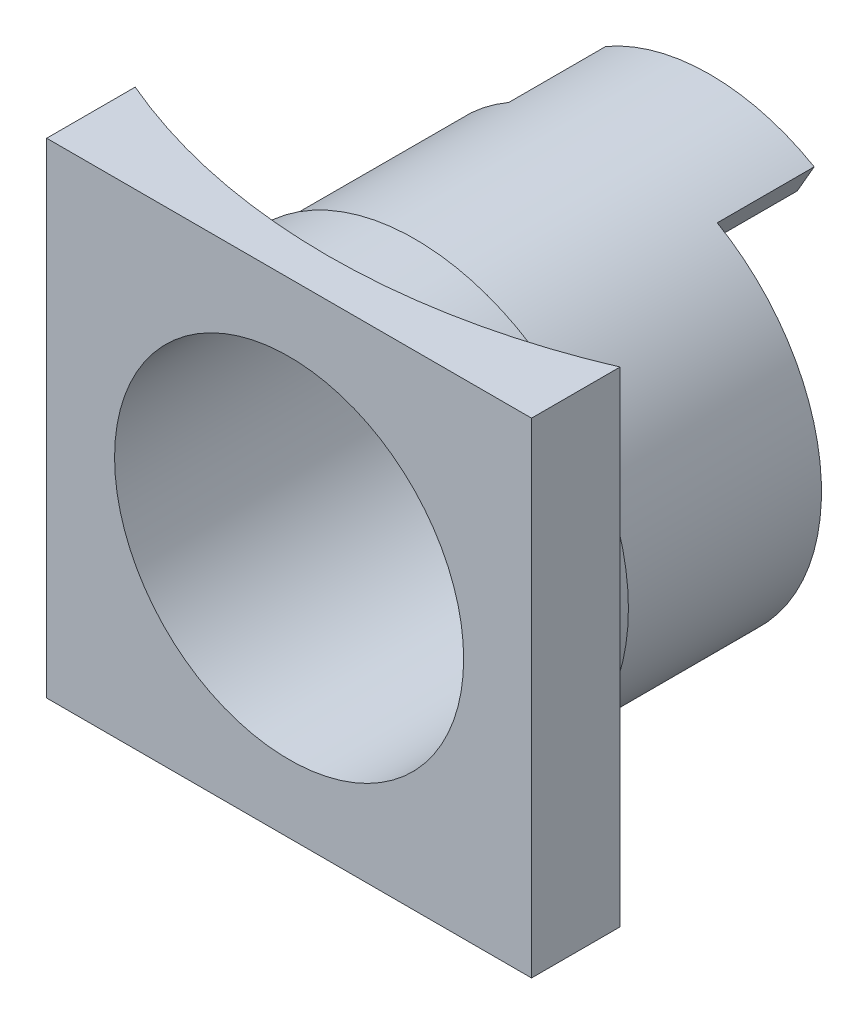
from build123d import *
from build123d.topology import SkipClean

# Parameters (mm, degrees)
EXTRUDE_1_DEPTH     = 25
SKETCH_2_R          = 9
CUT_EXTRUDE_2_DEPTH = 29.321046499
SKETCH_3_R          = 11
SKETCH_3_R_2        = 9
TUBE_DEPTH          = 16.7
SUPPORT_DEPTH       = 5
HOLDER_START        = -15.205
SKETCH_5_R          = 11
SKETCH_5_R_2        = 10.75
HOLDER_DEPTH        = 15.205


with BuildPart() as part:
    # Эскиз1 → Вытянуть1 (new body)
    with BuildSketch(Plane(origin=(0, 0, 0), x_dir=(1, 0, 0), z_dir=(0, 1, 0))):
        with BuildLine():
            Line((-12.5, -29.18582704), (-12.5, -33.75))
            Line((-12.5, -33.75), (12.5, -33.75))
            Line((12.5, -33.75), (12.5, -29.18582704))
            ThreePointArc((12.5, -29.18582704), (0, -31.75), (-12.5, -29.18582704))
        make_face()
    extrude(amount=EXTRUDE_1_DEPTH)

    # Эскиз2 → Вытянуть2 (cut, through all)
    with BuildSketch(Plane.XY.offset(33.75)):
        with Locations((0, 12.5)):
            Circle(SKETCH_2_R)
    extrude(amount=-CUT_EXTRUDE_2_DEPTH, mode=Mode.SUBTRACT)

    # Эскиз3 → tube (add)
    with BuildSketch(Plane.XY.offset(33.75)):
        with Locations((0, 12.5)):
            Circle(SKETCH_3_R)
        with Locations((0, 12.5)):
            Circle(SKETCH_3_R_2, mode=Mode.SUBTRACT)
    extrude(amount=-TUBE_DEPTH)

    # Эскиз4 → support (add)
    with SkipClean():  # the faces are left unmerged after this step: merging them gives an invalid solid
        with BuildSketch(Plane(origin=(0, 0, 17.05), x_dir=(-1, 0, 0), z_dir=(0, 0, -1))):
            with BuildLine():
                Line((-4.5, 20.294228634), (-5.5, 22.026279442))
                ThreePointArc((-5.5, 22.026279442), (0, 23.5), (5.5, 22.026279442))
                Line((5.5, 22.026279442), (4.5, 20.294228634))
                ThreePointArc((4.5, 20.294228634), (0, 21.5), (-4.5, 20.294228634))
            make_face()
        extrude(amount=SUPPORT_DEPTH)

    # Эскиз5 → holder (cut)
    with SkipClean():  # the faces are left unmerged after this step: merging them gives an invalid solid
        with BuildSketch(Plane(origin=(0, 0, 12.05), x_dir=(-1, 0, 0), z_dir=(0, 0, -1)).offset(HOLDER_START)):
            with Locations((0, 12.5)):
                Circle(SKETCH_5_R)
            with Locations((0, 12.5)):
                Circle(SKETCH_5_R_2, mode=Mode.SUBTRACT)
        extrude(amount=HOLDER_DEPTH, mode=Mode.SUBTRACT)


solid = part.part
